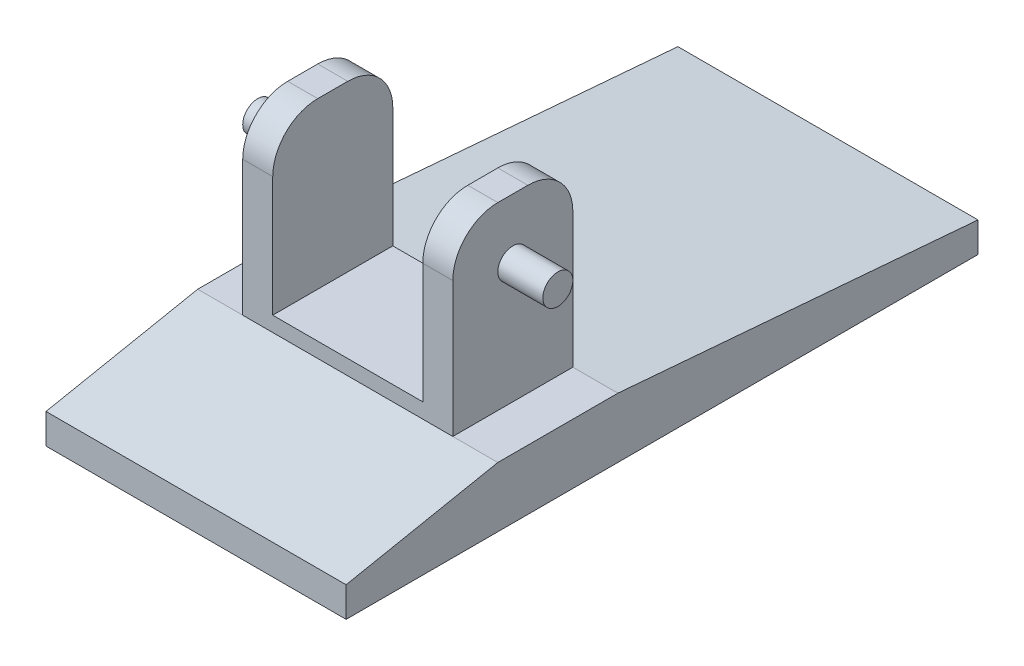
from build123d import *

# Parameters (mm, degrees)
BOSS_EXTRUDE1_DEPTH = 10
BOSS_EXTRUDE3_DEPTH = 25
SKETCH4_R           = 5
BOSS_EXTRUDE4_DEPTH = 15
BOSS_EXTRUDE6_DEPTH = 15


with BuildPart() as part:
    # Sketch1 → Boss-Extrude1 (new body)
    with BuildSketch(Plane(origin=(0, 0, 0), x_dir=(0, 0, -1), z_dir=(1, 0, 0))):
        with BuildLine():
            Line((-5, 61.125310432), (5, 61.125310432))
            ThreePointArc((5, 61.125310432), (15.606601718, 56.73191215), (20, 46.125310432))
            Line((20, 46.125310432), (20, 1.125310432))
            Line((20, 1.125310432), (140, -8.874689568))
            Line((140, -8.874689568), (140, -18.874689568))
            Line((140, -18.874689568), (-70.549785689, -18.874689568))
            Line((-70.549785689, -18.874689568), (-70.549785689, -8.874689568))
            Line((-70.549785689, -8.874689568), (-20, 1.125310432))
            Line((-20, 1.125310432), (-20, 46.125310432))
            ThreePointArc((-20, 46.125310432), (-15.606601718, 56.73191215), (-5, 61.125310432))
        make_face()
    boss_extrude1 = extrude(amount=BOSS_EXTRUDE1_DEPTH)

    # Sketch3 → Boss-Extrude3 (add)
    with BuildSketch(Plane.ZY):
        Polygon((20, 1.125310432), (70.549785689, -8.874689568), (70.549785689, -18.874689568), (-140, -18.874689568), (-140, -8.874689568), (-20, 1.125310432), (-20, 6.125310432), (20, 6.125310432), align=None)
    boss_extrude3 = extrude(amount=BOSS_EXTRUDE3_DEPTH)

    # Sketch4 → Boss-Extrude4 (add)
    with BuildSketch(Plane(origin=(10, 0, 0), x_dir=(0, 0, -1), z_dir=(1, 0, 0))):
        with Locations((0, 41.125310432)):
            Circle(SKETCH4_R)
    boss_extrude4 = extrude(amount=BOSS_EXTRUDE4_DEPTH)

    # Sketch7 → Boss-Extrude6 (add)
    with BuildSketch(Plane(origin=(10, 0, 0), x_dir=(0, 0, -1), z_dir=(1, 0, 0))):
        Polygon((-70.549785689, -8.874689568), (-20, 1.125310432), (20, 1.125310432), (140, -8.874689568), (140, -18.874689568), (-70.549785689, -18.874689568), align=None)
    boss_extrude6 = extrude(amount=BOSS_EXTRUDE6_DEPTH)

    # Mirror2: Boss-Extrude1, Boss-Extrude3, Boss-Extrude4, Boss-Extrude6 across plane
    add(boss_extrude1.mirror(Plane(origin=(-25, 0, 0), x_dir=(0, 0, 1), z_dir=(1, 0, 0))))
    add(boss_extrude3.mirror(Plane(origin=(-25, 0, 0), x_dir=(0, 0, 1), z_dir=(1, 0, 0))))
    add(boss_extrude4.mirror(Plane(origin=(-25, 0, 0), x_dir=(0, 0, 1), z_dir=(1, 0, 0))))
    add(boss_extrude6.mirror(Plane(origin=(-25, 0, 0), x_dir=(0, 0, 1), z_dir=(1, 0, 0))))


solid = part.part
